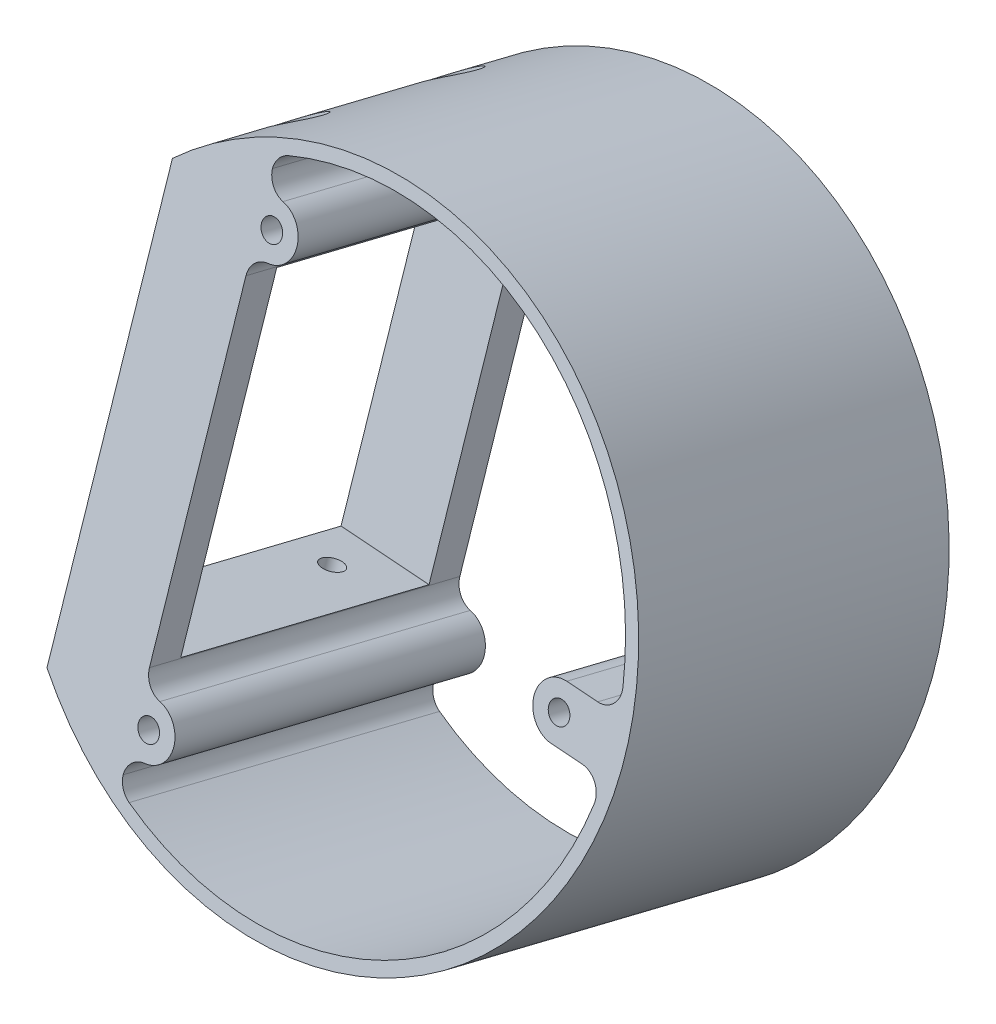
from build123d import *

# Parameters (mm, degrees)
SKETCH1_R               = 1.65
BOSS_EXTRUDE1_DEPTH     = 50
FILLET1_R               = 3
CUT_EXTRUDE1_DEPTH      = 2
BOSS_EXTRUDE2_DEPTH     = 50
CUT_EXTRUDE2_DEPTH      = 250.002778224
CUT_EXTRUDE2_DEPTH_BACK = 250.002778224
SKETCH6_R               = 1.65
SKETCH7_R               = 3.25
CUT_EXTRUDE3_DEPTH      = 252.239111365
BOSS_EXTRUDE3_DEPTH     = 12


with BuildPart() as part:
    # Sketch1 → Boss-Extrude1 (new body)
    with BuildSketch(Plane(origin=(0, -11.08370793, -45.136756885), x_dir=(-1, 0, 0), z_dir=(-1.1648668141184262e-15, -0.2384737410032823, -0.971148945760587))):
        with BuildLine():
            Line((190.572336887, 100.522287844), (195.806038021, 17.020141929))
            ThreePointArc((195.806038021, 17.020141929), (123.326279837, 54.392386356), (190.572336887, 100.522287844))
        make_face()
        with Locations(Location((191.201457584, 26.540811073, 0), (0, 0, 270))):
            Circle(SKETCH1_R, mode=Mode.SUBTRACT)
        with Locations(Location((133.805715979, 55.049210636, 0), (0, 0, 270))):
            Circle(SKETCH1_R, mode=Mode.SUBTRACT)
        with Locations(Location((187.192585024, 90.501181154, 0), (0, 0, 270))):
            Circle(SKETCH1_R, mode=Mode.SUBTRACT)
        with BuildLine():
            Line((188.652120726, 99.186744395), (188.971972285, 94.083607842))
            ThreePointArc((188.971972285, 94.083607842), (183.200418875, 90.25096238), (189.405363913, 87.168973239))
            Line((189.405363913, 87.168973239), (192.980844845, 30.123237762))
            ThreePointArc((192.980844845, 30.123237762), (187.209291435, 26.2905923), (193.414236473, 23.208603158))
            Line((193.414236473, 23.208603158), (193.734088033, 18.105466605))
            ThreePointArc((193.734088033, 18.105466605), (151.1433376, 16.296895841), (125.748401883, 50.536349554))
            Line((125.748401883, 50.536349554), (134.055934753, 51.057044486))
            ThreePointArc((134.055934753, 51.057044486), (137.797882129, 55.299429409), (133.555497206, 59.041376785))
            Line((133.555497206, 59.041376785), (125.247964337, 58.520681853))
            ThreePointArc((125.247964337, 58.520681853), (146.168867104, 95.663093972), (188.652120726, 99.186744395))
        make_face(mode=Mode.SUBTRACT)
    extrude(amount=BOSS_EXTRUDE1_DEPTH)

    # Fillet1
    # the kernel refuses this fillet: 3 mm, written as the material it adds along each edge
    with BuildSketch(Plane(origin=(-189.405363913, 73.570348534, -65.924268033), x_dir=(-0.06255469329064647, -0.9692469868574474, 0.2380066990970473), z_dir=(-1.1648668141184262e-15, -0.2384737410032823, -0.971148945760587)), Plane(origin=(-193.414236473, 11.45530256, -50.671399304), x_dir=(-0.06255469329064779, -0.9692469868574473, 0.23800669909704728), z_dir=(-1.1648668141184262e-15, -0.2384737410032823, -0.971148945760587))) as fillet1_piece_1:
        with BuildLine():
            CenterArc((3.464101615, -3), FILLET1_R, 90, 81.786789298)
            Line((0.494871659, -2.571428571), (0.43548706, -2.562857143))
            ThreePointArc((0.43548706, -2.562857143), (0.404901579, -1.255409988), (-0.051961524, -0.03))
            Line((-0.051961524, -0.03), (0, 0.06))
            Line((0, 0.06), (3.464101615, 0.06))
            Line((3.464101615, 0.06), (3.464101615, 0))
        make_face()
    extrude(amount=50)
    with BuildSketch(Plane(origin=(-188.971972285, 80.285488639, -67.573226814), x_dir=(0.9918790597948464, 0.12351522175531701, -0.030330195106964622), z_dir=(-1.1648668141184262e-15, -0.2384737410032823, -0.971148945760587)), Plane(origin=(-192.980844845, 18.170442665, -52.320358085), x_dir=(0.991879059794848, 0.1235152217553046, -0.030330195106961572), z_dir=(-1.1648668141184262e-15, -0.2384737410032823, -0.971148945760587))) as fillet1_piece_2:
        with BuildLine():
            CenterArc((3.600595189, -2.834733548), FILLET1_R, 109.106605351, 81.786789298)
            Line((0.654653671, -3.401680257), (0.59573484, -3.413019191))
            Line((0.59573484, -3.413019191), (-0.05891883, -0.011338934))
            Line((-0.05891883, -0.011338934), (0.01963961, 0.056694671))
            ThreePointArc((0.01963961, 0.056694671), (1.309307341, -0.16035527), (2.598975073, 0.056694671))
            Line((2.598975073, 0.056694671), (2.618614683, 0))
        make_face()
    extrude(amount=50)
    with BuildSketch(Plane(origin=(-188.652120726, 85.241394323, -68.790190879), x_dir=(-0.06255469329064652, -0.9692469868574474, 0.2380066990970473), z_dir=(-1.1648668141184262e-15, -0.2384737410032823, -0.971148945760587))) as fillet1_piece_3:
        with BuildLine():
            CenterArc((1.890358561, -3), FILLET1_R, 90, 65.684260829)
            Line((-0.843512036, -1.764705882), (-0.898189448, -1.74))
            ThreePointArc((-0.898189448, -1.74), (-0.485373447, -0.851944437), (-0.053565088, 0.027032967))
            Line((-0.053565088, 0.027032967), (0, 0.06))
            Line((0, 0.06), (1.890358561, 0.06))
            Line((1.890358561, 0.06), (1.890358561, 0))
        make_face()
    extrude(amount=50)
    with BuildSketch(Plane(origin=(-125.247964337, 45.748590557, -59.092402813), x_dir=(-0.998041537385751, 0.06074992444158681, -0.014917651726331855), z_dir=(-1.1648668141184262e-15, -0.2384737410032823, -0.971148945760587))) as fillet1_piece_4:
        with BuildLine():
            CenterArc((3.404268952, 3), FILLET1_R, 170.519850992, 99.480149008)
            Line((0.445240775, 3.494117647), (0.386060211, 3.504))
            ThreePointArc((0.386060211, 3.504), (0.129276951, 1.758953187), (-0.059767694, 0.005274725))
            Line((-0.059767694, 0.005274725), (0, -0.06))
            Line((0, -0.06), (3.404268952, -0.06))
            Line((3.404268952, -0.06), (3.404268952, 0))
        make_face()
    extrude(amount=50)
    with BuildSketch(Plane(origin=(-125.748401883, 37.994614662, -57.18834922), x_dir=(-0.9980415373857512, 0.06074992444158377, -0.014917651726331107), z_dir=(-1.1648668141184262e-15, -0.2384737410032823, -0.971148945760587))) as fillet1_piece_5:
        with BuildLine():
            CenterArc((3.404268952, -3), FILLET1_R, 90, 99.480149008)
            Line((0.445240775, -3.494117647), (0.386060211, -3.504))
            ThreePointArc((0.386060211, -3.504), (0.129276951, -1.758953187), (-0.059767694, -0.005274725))
            Line((-0.059767694, -0.005274725), (0, 0.06))
            Line((0, 0.06), (3.404268952, 0.06))
            Line((3.404268952, 0.06), (3.404268952, 0))
        make_face()
    extrude(amount=50)
    with BuildSketch(Plane(origin=(-193.734088033, 6.499396876, -49.454435239), x_dir=(0.8734851551122291, -0.472804623546926, 0.1161011272607396), z_dir=(-1.1648668141184262e-15, -0.2384737410032823, -0.971148945760587))) as fillet1_piece_6:
        with BuildLine():
            CenterArc((1.891457997, -2.999306942), FILLET1_R, 88.768398789, 65.684260829)
            Line((-0.815229808, -1.705536822), (-0.869363564, -1.679661419))
            Line((-0.869363564, -1.679661419), (-0.054133756, 0.025875402))
            Line((-0.054133756, 0.025875402), (-0.00128963, 0.059986139))
            ThreePointArc((-0.00128963, 0.059986139), (0.97796976, 0.070511377), (1.957229151, 0.059986139))
            Line((1.957229151, 0.059986139), (1.95593952, 0))
        make_face()
    extrude(amount=50)

    # Sketch2 → Cut-Extrude1 (cut)
    with BuildSketch(Plane(origin=(-196.102436043, 11.936585529, -2.931128349), x_dir=(-0.012161961241733214, -0.42236542058855414, -0.9063440506727058), z_dir=(-0.9980415373857511, 0.06074992444158637, -0.014917651726331723))):
        Polygon((36.580430473, -80.213866538), (75.817155722, -87.990716269), (85.538217885, -38.944809708), (46.301492636, -31.167959977), align=None)
    extrude(amount=-CUT_EXTRUDE1_DEPTH, mode=Mode.SUBTRACT)

    # Sketch5 → Boss-Extrude2 (add)
    with BuildSketch(Plane(origin=(0, -11.08370793, -45.136756885), x_dir=(1, 0, 0), z_dir=(1.1648668141184262e-15, 0.2384737410032823, 0.971148945760587))):
        with BuildLine():
            Line((-194.753054786, 33.820176452), (-206.729553235, 34.570832771))
            Line((-206.729553235, 34.570832771), (-207.208075084, 26.936158901))
            ThreePointArc((-207.208075084, 26.936158901), (-201.903893564, 21.521843178), (-195.806038021, 17.020141929))
            Line((-195.806038021, 17.020141929), (-194.753054786, 33.820176452))
        make_face()
        with BuildLine():
            Line((-191.625320122, 83.722253321), (-203.60181857, 84.472909641))
            Line((-203.60181857, 84.472909641), (-203.123296721, 92.107583511))
            ThreePointArc((-203.123296721, 92.107583511), (-197.184571584, 96.817222573), (-190.572336887, 100.522287844))
            Line((-190.572336887, 100.522287844), (-191.625320122, 83.722253321))
        make_face()
    extrude(amount=-BOSS_EXTRUDE2_DEPTH)

    # Sketch6 → Cut-Extrude2 (cut, two sides: drawn at the far end of the back side and taken through both)
    with BuildSketch(Plane(origin=(4.477115921, 69.370192521, -17.034430606), x_dir=(0.9980415373857511, -0.060749924441585876, 0.014917651726333775), z_dir=(-0.06255469329064432, -0.9692469868574474, 0.23800669909704822)).offset(-CUT_EXTRUDE2_DEPTH_BACK)):
        with Locations(Location((-202.487248974, -58.977687158, 0), (0, 0, 270))):
            Circle(SKETCH6_R)
        with Locations(Location((-202.487248974, -83.977687158, 0), (0, 0, 270))):
            Circle(SKETCH6_R)
    extrude(amount=CUT_EXTRUDE2_DEPTH + CUT_EXTRUDE2_DEPTH_BACK, mode=Mode.SUBTRACT)

    # Sketch7 → Cut-Extrude3 (cut, through all)
    with BuildSketch(Plane(origin=(4.955637771, 76.784598001, -18.855099845), x_dir=(-0.9980415373857511, 0.060749924441585876, -0.014917651726333775), z_dir=(-0.06255469329064432, -0.9692469868574474, 0.23800669909704822))):
        with Locations(Location((202.487248974, 83.977687158, 0), (0, 0, 90))):
            Circle(SKETCH7_R)
        with Locations(Location((202.487248974, 58.977687158, 0), (0, 0, 90))):
            Circle(SKETCH7_R)
    cut_extrude3 = extrude(amount=-CUT_EXTRUDE3_DEPTH, mode=Mode.SUBTRACT)

    # Mirror1: Cut-Extrude3 across plane
    add(cut_extrude3.mirror(Plane(origin=(2.913248589, 45.139017849, -11.084263128), x_dir=(0.01532893583235174, 0.2375125523868593, 0.9712635127425137), z_dir=(-0.06255469329064435, -0.9692469868574474, 0.23800669909704839))), mode=Mode.SUBTRACT)

    # Sketch9 → Boss-Extrude3 (add)
    with BuildSketch(Plane(origin=(-196.102436043, 11.936585529, -2.931128349), x_dir=(-0.013708702589388168, 0.02026883912221751, 0.9997005779902068), z_dir=(-0.998041537385751, 0.06074992444158621, -0.014917651726331664))):
        Polygon((-65.911006882, 58.550247227), (-54.953633527, 9.765659813), (-50.075174786, 10.861397149), (-61.03254814, 59.645984563), align=None)
        Polygon((-109.817135555, 48.688611208), (-98.8597622, -0.095976206), (-93.981303459, 0.999761129), (-104.938676813, 49.784348544), align=None)
    extrude(amount=BOSS_EXTRUDE3_DEPTH)


solid = part.part
